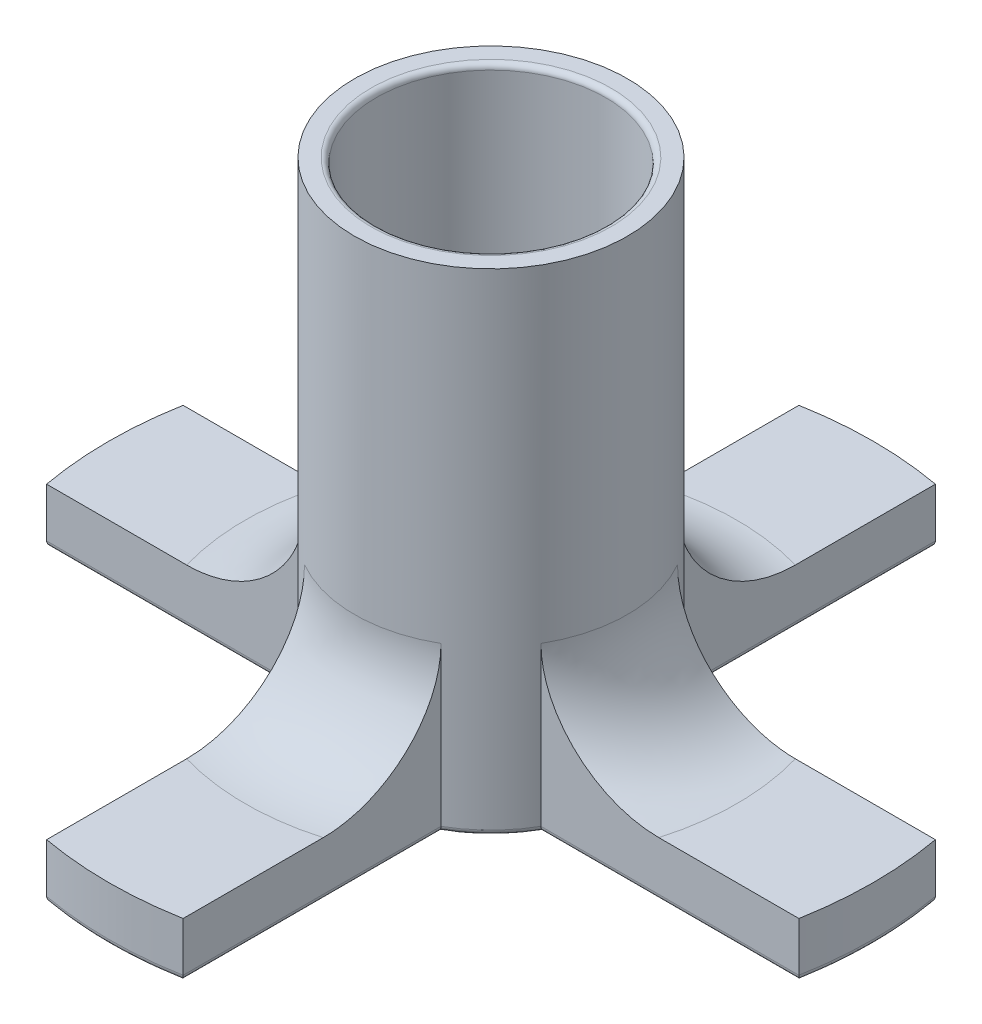
from build123d import *

# Parameters (mm, degrees)
BOSS_EXTRUDE1_DEPTH = 10
SKETCH2_R           = 25
SKETCH2_R_2         = 21
BOSS_EXTRUDE2_DEPTH = 80
FILLET1_R           = 1
FILLET2_R           = 20


with BuildPart() as part:
    # Sketch1 → Boss-Extrude1 (new body)
    with BuildSketch(Plane(origin=(0, 0, 0), x_dir=(1, 0, 0), z_dir=(0, 1, 0))):
        with BuildLine():
            Line((-68.87488657, 12.5), (-21.650635095, 12.5))
            ThreePointArc((-21.650635095, 12.5), (-17.67766953, 17.67766953), (-12.5, 21.650635095))
            Line((-12.5, 21.650635095), (-12.5, 68.87488657))
            ThreePointArc((-12.5, 68.87488657), (0, 70), (12.5, 68.87488657))
            Line((12.5, 68.87488657), (12.5, 21.650635095))
            ThreePointArc((12.5, 21.650635095), (17.67766953, 17.67766953), (21.650635095, 12.5))
            Line((21.650635095, 12.5), (68.87488657, 12.5))
            ThreePointArc((68.87488657, 12.5), (70, 0), (68.87488657, -12.5))
            Line((68.87488657, -12.5), (21.650635095, -12.5))
            ThreePointArc((21.650635095, -12.5), (17.67766953, -17.67766953), (12.5, -21.650635095))
            Line((12.5, -21.650635095), (12.5, -68.87488657))
            ThreePointArc((12.5, -68.87488657), (0, -70), (-12.5, -68.87488657))
            Line((-12.5, -68.87488657), (-12.5, -21.650635095))
            ThreePointArc((-12.5, -21.650635095), (-17.67766953, -17.67766953), (-21.650635095, -12.5))
            Line((-21.650635095, -12.5), (-68.87488657, -12.5))
            ThreePointArc((-68.87488657, -12.5), (-70, 0), (-68.87488657, 12.5))
        make_face()
    extrude(amount=BOSS_EXTRUDE1_DEPTH)

    # Sketch2 → Boss-Extrude2 (add)
    with BuildSketch(Plane(origin=(0, 10, 0), x_dir=(1, 0, 0), z_dir=(0, 1, 0))):
        with Locations(Location((0, 0, 0), (0, 0, 120))):
            Circle(SKETCH2_R)
        with Locations(Location((0, 0, 0), (0, 0, 270))):
            Circle(SKETCH2_R_2, mode=Mode.SUBTRACT)
    extrude(amount=BOSS_EXTRUDE2_DEPTH)

    # Fillet1
    fillet1_edges = [part.edges().sort_by_distance(p)[0] for p in [
        (-45.262760832, 0, -12.5),
        (-17.67766953, 0, -17.67766953),
        (-12.5, 0, -45.262760832),
        (0, 0, -70),
        (12.5, 0, -45.262760832),
        (17.67766953, 0, -17.67766953),
        (45.262760832, 0, -12.5),
        (70, 0, 0),
        (45.262760832, 0, 12.5),
        (17.67766953, 0, 17.67766953),
        (12.5, 0, 45.262760832),
        (0, 0, 70),
        (-12.5, 0, 45.262760832),
        (-17.67766953, 0, 17.67766953),
        (-45.262760832, 0, 12.5),
        (-70, 0, 0),
        (0, 90, -21),
    ]]
    fillet(fillet1_edges, radius=FILLET1_R)

    # Fillet2
    # the kernel refuses this fillet: 20 mm, written as the material it adds along each edge
    with BuildSketch(Plane(origin=(0, 10, 0), x_dir=(-0.5791102310921431, 0, -0.8152492503795417), z_dir=(0.8152492503795417, 0, -0.5791102310921431))) as fillet2_piece_1_section:
        with BuildLine():
            CenterArc((25 + FILLET2_R, FILLET2_R), FILLET2_R, 180, 90)
            Line((25 + FILLET2_R, 0), (25, 0))
            Line((25, 0), (25, FILLET2_R))
        make_face()
    fillet2_piece_1 = revolve(axis=Axis((0, 10, 0), (0, 1, 0)), revolution_arc=289.224029318, mode=Mode.PRIVATE)
    fillet2_piece_1 = split(fillet2_piece_1, bisect_by=Plane(origin=(-28.534533207, 14.552524817, -12.5), z_dir=(0, 0, 1)), keep=Keep.TOP, mode=Mode.PRIVATE)
    fillet2_piece_1 = split(fillet2_piece_1, bisect_by=Plane(origin=(-28.534533207, 14.552524817, 12.5), z_dir=(0, 0, -1)), keep=Keep.TOP, mode=Mode.PRIVATE)
    fillet2_piece_1 = split(fillet2_piece_1, bisect_by=Plane(origin=(12.5, 14.552524817, 2.701e-06), z_dir=(-1, 0, 0)), keep=Keep.TOP, mode=Mode.PRIVATE)
    add(fillet2_piece_1)
    with BuildSketch(Plane(origin=(0, 10, 0), x_dir=(-0.5791102310921431, 0, -0.8152492503795417), z_dir=(0.8152492503795417, 0, -0.5791102310921431))) as fillet2_piece_2_section:
        with BuildLine():
            CenterArc((25 + FILLET2_R, FILLET2_R), FILLET2_R, 180, 90)
            Line((25 + FILLET2_R, 0), (25, 0))
            Line((25, 0), (25, FILLET2_R))
        make_face()
    fillet2_piece_2 = revolve(axis=Axis((0, 10, 0), (0, 1, 0)), revolution_arc=289.224029318, mode=Mode.PRIVATE)
    fillet2_piece_2 = split(fillet2_piece_2, bisect_by=Plane(origin=(-12.5, 14.552524817, 28.534533207), z_dir=(1, 0, 0)), keep=Keep.TOP, mode=Mode.PRIVATE)
    fillet2_piece_2 = split(fillet2_piece_2, bisect_by=Plane(origin=(12.5, 14.552524817, 28.534533207), z_dir=(-1, 0, 0)), keep=Keep.TOP, mode=Mode.PRIVATE)
    add(fillet2_piece_2)
    with BuildSketch(Plane(origin=(0, 10, 0), x_dir=(-0.5791102310921431, 0, -0.8152492503795417), z_dir=(0.8152492503795417, 0, -0.5791102310921431))) as fillet2_piece_3_section:
        with BuildLine():
            CenterArc((25 + FILLET2_R, FILLET2_R), FILLET2_R, 180, 90)
            Line((25 + FILLET2_R, 0), (25, 0))
            Line((25, 0), (25, FILLET2_R))
        make_face()
    fillet2_piece_3 = revolve(axis=Axis((0, 10, 0), (0, 1, 0)), revolution_arc=289.224029318, mode=Mode.PRIVATE)
    fillet2_piece_3 = split(fillet2_piece_3, bisect_by=Plane(origin=(28.534533207, 14.552524817, -12.5), z_dir=(0, 0, 1)), keep=Keep.TOP, mode=Mode.PRIVATE)
    fillet2_piece_3 = split(fillet2_piece_3, bisect_by=Plane(origin=(28.534533207, 14.552524817, 12.5), z_dir=(0, 0, -1)), keep=Keep.TOP, mode=Mode.PRIVATE)
    fillet2_piece_3 = split(fillet2_piece_3, bisect_by=Plane(origin=(12.5, 14.552524817, -2.701e-06), z_dir=(1, 0, 0)), keep=Keep.TOP, mode=Mode.PRIVATE)
    add(fillet2_piece_3)
    with BuildSketch(Plane(origin=(0, 10, 0), x_dir=(0.8152492503795357, 0, -0.5791102310921514), z_dir=(0.5791102310921514, 0, 0.8152492503795357))) as fillet2_piece_4_section:
        with BuildLine():
            CenterArc((25 + FILLET2_R, FILLET2_R), FILLET2_R, 180, 90)
            Line((25, FILLET2_R), (25, 0))
            Line((25, 0), (25 + FILLET2_R, 0))
        make_face()
    fillet2_piece_4 = revolve(axis=Axis((0, 10, 0), (0, 1, 0)), revolution_arc=289.224029318, mode=Mode.PRIVATE)
    fillet2_piece_4 = split(fillet2_piece_4, bisect_by=Plane(origin=(-5.76e-07, 14.552525886, 12.5), z_dir=(0, 0, -1)), keep=Keep.TOP, mode=Mode.PRIVATE)
    fillet2_piece_4 = split(fillet2_piece_4, bisect_by=Plane(origin=(-12.5, 14.552525886, -28.534534116), z_dir=(1, 0, 0)), keep=Keep.TOP, mode=Mode.PRIVATE)
    fillet2_piece_4 = split(fillet2_piece_4, bisect_by=Plane(origin=(12.5, 14.552525886, -28.534534116), z_dir=(-1, 0, 0)), keep=Keep.TOP, mode=Mode.PRIVATE)
    add(fillet2_piece_4)
    with BuildSketch(Plane(origin=(0, 10, 0), x_dir=(0.8152492503795357, 0, -0.5791102310921514), z_dir=(0.5791102310921514, 0, 0.8152492503795357))) as fillet2_piece_5_section:
        with BuildLine():
            CenterArc((25 + FILLET2_R, FILLET2_R), FILLET2_R, 180, 90)
            Line((25, FILLET2_R), (25, 0))
            Line((25, 0), (25 + FILLET2_R, 0))
        make_face()
    fillet2_piece_5 = revolve(axis=Axis((0, 10, 0), (0, 1, 0)), revolution_arc=289.224029318, mode=Mode.PRIVATE)
    fillet2_piece_5 = split(fillet2_piece_5, bisect_by=Plane(origin=(-28.534534116, 14.552525886, -12.5), z_dir=(0, 0, 1)), keep=Keep.TOP, mode=Mode.PRIVATE)
    fillet2_piece_5 = split(fillet2_piece_5, bisect_by=Plane(origin=(-28.534534116, 14.552525886, 12.5), z_dir=(0, 0, -1)), keep=Keep.TOP, mode=Mode.PRIVATE)
    add(fillet2_piece_5)
    with BuildSketch(Plane(origin=(0, 10, 0), x_dir=(0.8152492503795357, 0, -0.5791102310921514), z_dir=(0.5791102310921514, 0, 0.8152492503795357))) as fillet2_piece_6_section:
        with BuildLine():
            CenterArc((25 + FILLET2_R, FILLET2_R), FILLET2_R, 180, 90)
            Line((25, FILLET2_R), (25, 0))
            Line((25, 0), (25 + FILLET2_R, 0))
        make_face()
    fillet2_piece_6 = revolve(axis=Axis((0, 10, 0), (0, 1, 0)), revolution_arc=289.224029318, mode=Mode.PRIVATE)
    fillet2_piece_6 = split(fillet2_piece_6, bisect_by=Plane(origin=(5.76e-07, 14.552525886, 12.5), z_dir=(0, 0, 1)), keep=Keep.TOP, mode=Mode.PRIVATE)
    fillet2_piece_6 = split(fillet2_piece_6, bisect_by=Plane(origin=(-12.5, 14.552525886, 28.534534116), z_dir=(1, 0, 0)), keep=Keep.TOP, mode=Mode.PRIVATE)
    fillet2_piece_6 = split(fillet2_piece_6, bisect_by=Plane(origin=(12.5, 14.552525886, 28.534534116), z_dir=(-1, 0, 0)), keep=Keep.TOP, mode=Mode.PRIVATE)
    add(fillet2_piece_6)
    with BuildSketch(Plane(origin=(0, 10, 0), x_dir=(0.5791102310921488, 0, 0.8152492503795377), z_dir=(-0.8152492503795377, 0, 0.5791102310921488))) as fillet2_piece_7_section:
        with BuildLine():
            CenterArc((25 + FILLET2_R, FILLET2_R), FILLET2_R, 180, 90)
            Line((25 + FILLET2_R, 0), (25, 0))
            Line((25, 0), (25, FILLET2_R))
        make_face()
    fillet2_piece_7 = revolve(axis=Axis((0, 10, 0), (0, 1, 0)), revolution_arc=289.224029318, mode=Mode.PRIVATE)
    fillet2_piece_7 = split(fillet2_piece_7, bisect_by=Plane(origin=(28.534533207, 14.552524817, -12.5), z_dir=(0, 0, 1)), keep=Keep.TOP, mode=Mode.PRIVATE)
    fillet2_piece_7 = split(fillet2_piece_7, bisect_by=Plane(origin=(28.534533207, 14.552524817, 12.5), z_dir=(0, 0, -1)), keep=Keep.TOP, mode=Mode.PRIVATE)
    fillet2_piece_7 = split(fillet2_piece_7, bisect_by=Plane(origin=(12.5, 14.552524817, -2.701e-06), z_dir=(1, 0, 0)), keep=Keep.TOP, mode=Mode.PRIVATE)
    add(fillet2_piece_7)
    with BuildSketch(Plane(origin=(0, 10, 0), x_dir=(0.5791102310921488, 0, 0.8152492503795377), z_dir=(-0.8152492503795377, 0, 0.5791102310921488))) as fillet2_piece_8_section:
        with BuildLine():
            CenterArc((25 + FILLET2_R, FILLET2_R), FILLET2_R, 180, 90)
            Line((25 + FILLET2_R, 0), (25, 0))
            Line((25, 0), (25, FILLET2_R))
        make_face()
    fillet2_piece_8 = revolve(axis=Axis((0, 10, 0), (0, 1, 0)), revolution_arc=289.224029318, mode=Mode.PRIVATE)
    fillet2_piece_8 = split(fillet2_piece_8, bisect_by=Plane(origin=(-12.5, 14.552524817, -28.534533207), z_dir=(1, 0, 0)), keep=Keep.TOP, mode=Mode.PRIVATE)
    fillet2_piece_8 = split(fillet2_piece_8, bisect_by=Plane(origin=(12.5, 14.552524817, -28.534533207), z_dir=(-1, 0, 0)), keep=Keep.TOP, mode=Mode.PRIVATE)
    add(fillet2_piece_8)
    with BuildSketch(Plane(origin=(0, 10, 0), x_dir=(0.5791102310921488, 0, 0.8152492503795377), z_dir=(-0.8152492503795377, 0, 0.5791102310921488))) as fillet2_piece_9_section:
        with BuildLine():
            CenterArc((25 + FILLET2_R, FILLET2_R), FILLET2_R, 180, 90)
            Line((25 + FILLET2_R, 0), (25, 0))
            Line((25, 0), (25, FILLET2_R))
        make_face()
    fillet2_piece_9 = revolve(axis=Axis((0, 10, 0), (0, 1, 0)), revolution_arc=289.224029318, mode=Mode.PRIVATE)
    fillet2_piece_9 = split(fillet2_piece_9, bisect_by=Plane(origin=(-28.534533207, 14.552524817, -12.5), z_dir=(0, 0, 1)), keep=Keep.TOP, mode=Mode.PRIVATE)
    fillet2_piece_9 = split(fillet2_piece_9, bisect_by=Plane(origin=(-28.534533207, 14.552524817, 12.5), z_dir=(0, 0, -1)), keep=Keep.TOP, mode=Mode.PRIVATE)
    fillet2_piece_9 = split(fillet2_piece_9, bisect_by=Plane(origin=(12.5, 14.552524817, 2.701e-06), z_dir=(-1, 0, 0)), keep=Keep.TOP, mode=Mode.PRIVATE)
    add(fillet2_piece_9)
    with BuildSketch(Plane(origin=(0, 10, 0), x_dir=(-0.8152492503795393, 0, 0.5791102310921463), z_dir=(-0.5791102310921463, 0, -0.8152492503795393))) as fillet2_piece_10_section:
        with BuildLine():
            CenterArc((25 + FILLET2_R, FILLET2_R), FILLET2_R, 180, 90)
            Line((25 + FILLET2_R, 0), (25, 0))
            Line((25, 0), (25, FILLET2_R))
        make_face()
    fillet2_piece_10 = revolve(axis=Axis((0, 10, 0), (0, 1, 0)), revolution_arc=289.224029318, mode=Mode.PRIVATE)
    fillet2_piece_10 = split(fillet2_piece_10, bisect_by=Plane(origin=(-12.5, 14.552524817, 28.534533207), z_dir=(1, 0, 0)), keep=Keep.TOP, mode=Mode.PRIVATE)
    fillet2_piece_10 = split(fillet2_piece_10, bisect_by=Plane(origin=(2.701e-06, 14.552524817, 12.5), z_dir=(0, 0, 1)), keep=Keep.TOP, mode=Mode.PRIVATE)
    fillet2_piece_10 = split(fillet2_piece_10, bisect_by=Plane(origin=(12.5, 14.552524817, 28.534533207), z_dir=(-1, 0, 0)), keep=Keep.TOP, mode=Mode.PRIVATE)
    add(fillet2_piece_10)
    with BuildSketch(Plane(origin=(0, 10, 0), x_dir=(-0.8152492503795393, 0, 0.5791102310921463), z_dir=(-0.5791102310921463, 0, -0.8152492503795393))) as fillet2_piece_11_section:
        with BuildLine():
            CenterArc((25 + FILLET2_R, FILLET2_R), FILLET2_R, 180, 90)
            Line((25 + FILLET2_R, 0), (25, 0))
            Line((25, 0), (25, FILLET2_R))
        make_face()
    fillet2_piece_11 = revolve(axis=Axis((0, 10, 0), (0, 1, 0)), revolution_arc=289.224029318, mode=Mode.PRIVATE)
    fillet2_piece_11 = split(fillet2_piece_11, bisect_by=Plane(origin=(28.534533207, 14.552524817, -12.5), z_dir=(0, 0, 1)), keep=Keep.TOP, mode=Mode.PRIVATE)
    fillet2_piece_11 = split(fillet2_piece_11, bisect_by=Plane(origin=(28.534533207, 14.552524817, 12.5), z_dir=(0, 0, -1)), keep=Keep.TOP, mode=Mode.PRIVATE)
    add(fillet2_piece_11)
    with BuildSketch(Plane(origin=(0, 10, 0), x_dir=(-0.8152492503795393, 0, 0.5791102310921463), z_dir=(-0.5791102310921463, 0, -0.8152492503795393))) as fillet2_piece_12_section:
        with BuildLine():
            CenterArc((25 + FILLET2_R, FILLET2_R), FILLET2_R, 180, 90)
            Line((25 + FILLET2_R, 0), (25, 0))
            Line((25, 0), (25, FILLET2_R))
        make_face()
    fillet2_piece_12 = revolve(axis=Axis((0, 10, 0), (0, 1, 0)), revolution_arc=289.224029318, mode=Mode.PRIVATE)
    fillet2_piece_12 = split(fillet2_piece_12, bisect_by=Plane(origin=(-12.5, 14.552524817, -28.534533207), z_dir=(1, 0, 0)), keep=Keep.TOP, mode=Mode.PRIVATE)
    fillet2_piece_12 = split(fillet2_piece_12, bisect_by=Plane(origin=(-2.701e-06, 14.552524817, 12.5), z_dir=(0, 0, -1)), keep=Keep.TOP, mode=Mode.PRIVATE)
    fillet2_piece_12 = split(fillet2_piece_12, bisect_by=Plane(origin=(12.5, 14.552524817, -28.534533207), z_dir=(-1, 0, 0)), keep=Keep.TOP, mode=Mode.PRIVATE)
    add(fillet2_piece_12)


solid = part.part
